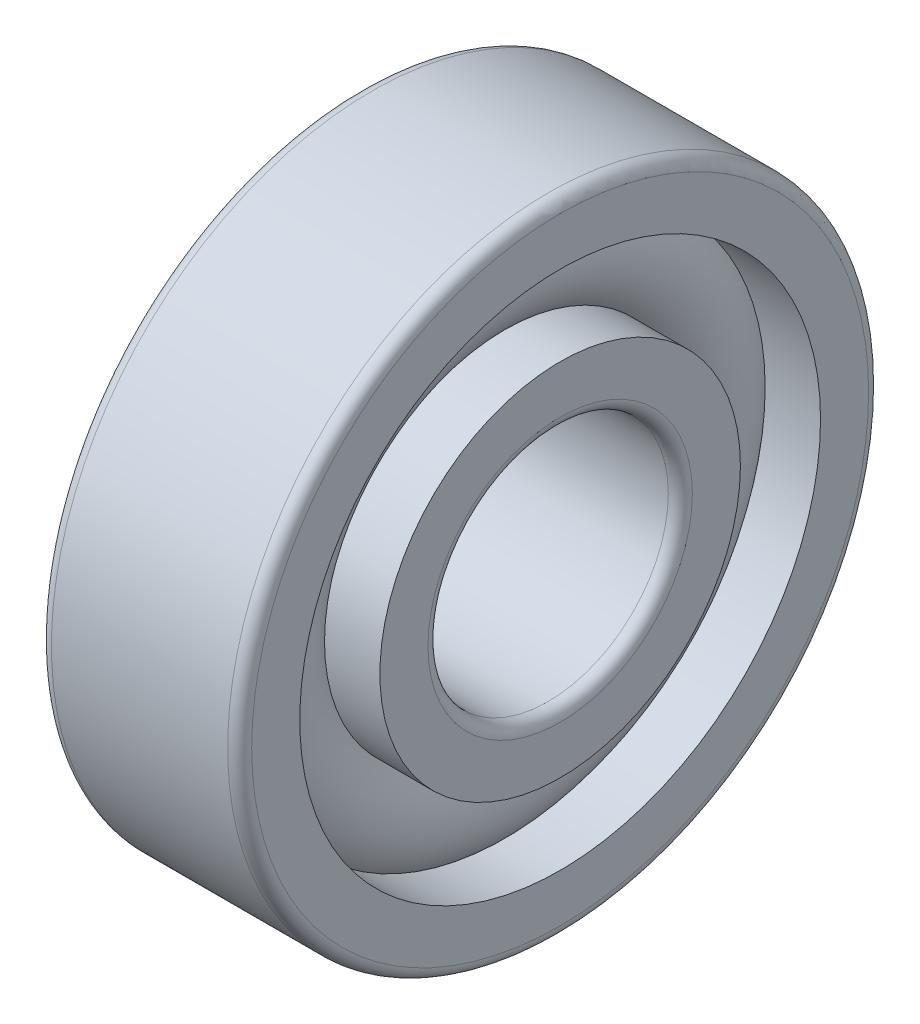
from build123d import *

# Parameters (mm, degrees)
CAGSPISKE_W     = 0.6
CAGSPISKE_H     = 1
CAGESPINE_ANGLE = 0.001
BALSIMSKE_R     = 3


with BuildPart() as part:
    # CagSpiSke → CageSpine (revolve)
    with BuildSketch(Plane.XY):
        with Locations((0, 11)):
            Rectangle(CAGSPISKE_W, CAGSPISKE_H)
    revolve(axis=Axis((-20.6375, 0, 0), (-1, 0, 0)), revolution_arc=CAGESPINE_ANGLE)

    # BalSimSke → BallsSimplified (revolve)
    with BuildSketch(Plane.XY):
        with Locations((0, 11)):
            Circle(BALSIMSKE_R)
    revolve(axis=Axis((-10, 0, 0), (1, 0, 0)))

    # InnRacSke → InnerRace (revolve)
    with BuildSketch(Plane.XY):
        with BuildLine():
            Line((-2.202413449, 9), (-5, 9))
            Line((-5, 9), (-5, 6.6))
            ThreePointArc((-5, 6.6), (-4.824264069, 6.175735931), (-4.4, 6))
            Line((-4.4, 6), (4.4, 6))
            ThreePointArc((4.4, 6), (4.824264069, 6.175735931), (5, 6.6))
            Line((5, 6.6), (5, 9))
            Line((5, 9), (2.202413449, 9))
            ThreePointArc((2.202413449, 9), (0, 8.025), (-2.202413449, 9))
        make_face()
    revolve(axis=Axis((-20.6375, 0, 0), (1, 0, 0)))

    # OutRacSke → OuterRace (revolve)
    with BuildSketch(Plane.XY):
        with BuildLine():
            Line((-2.202413449, 13), (-5, 13))
            Line((-5, 13), (-5, 15.4))
            ThreePointArc((-5, 15.4), (-4.824264069, 15.824264069), (-4.4, 16))
            Line((-4.4, 16), (4.4, 16))
            ThreePointArc((4.4, 16), (4.824264069, 15.824264069), (5, 15.4))
            Line((5, 15.4), (5, 13))
            Line((5, 13), (2.202413449, 13))
            ThreePointArc((2.202413449, 13), (0, 13.975), (-2.202413449, 13))
        make_face()
    revolve(axis=Axis((-20.6375, 0, 0), (1, 0, 0)))


solid = part.part
